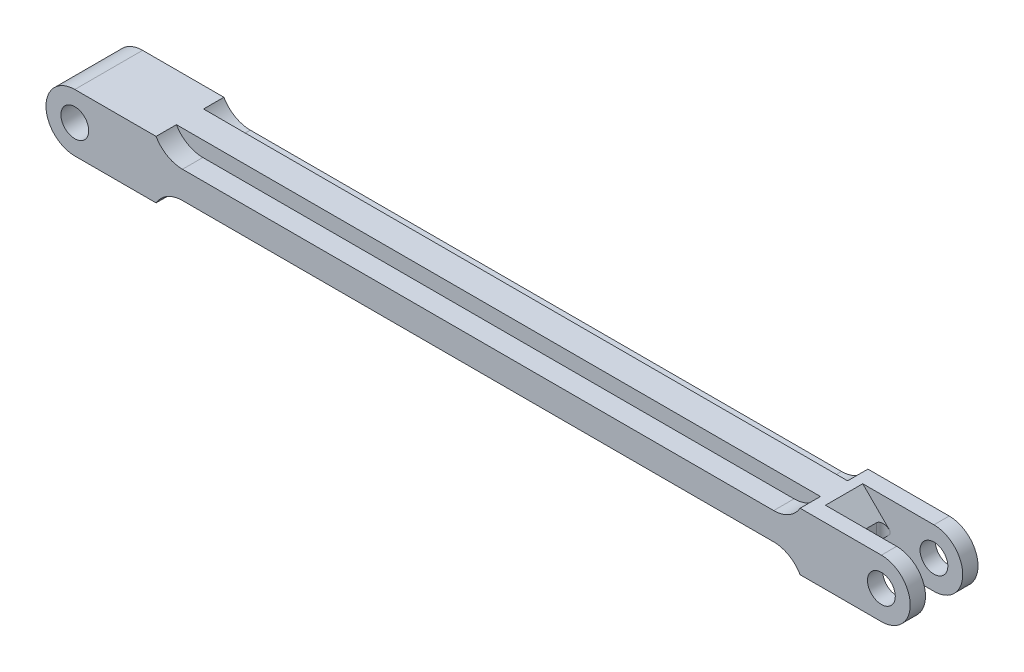
from build123d import *

# Parameters (mm, degrees)
ESBO_O1_R                = 4.1
RESSALTO_EXTRUS_O1_DEPTH = 10
ESBO_O2_W                = 23.5
ESBO_O2_H                = 11
CORTE_EXTRUS_O1_DEPTH    = 219.274311432
FILETE1_R                = 2
ESBO_O4_W                = 190
ESBO_O4_H                = 36.622024969
CORTE_EXTRUS_O3_DEPTH    = 289.339020898
RESSALTO_EXTRUS_O2_DEPTH = 190
FILETE3_R                = 9
CORTE_EXTRUS_O4_DEPTH    = 5.5


with BuildPart() as part:
    # Esboço1 → Ressalto-extrusão1 (new, symmetric)
    with BuildSketch(Plane.XY):
        with BuildLine():
            Line((-29.071712183, 188.373872767), (208.88140452, 188.373872767))
            ThreePointArc((208.88140452, 188.373872767), (217.38140452, 179.873872767), (208.88140452, 171.373872767))
            Line((208.88140452, 171.373872767), (-29.071712183, 171.373872767))
            ThreePointArc((-29.071712183, 171.373872767), (-37.571712183, 179.873872767), (-29.071712183, 188.373872767))
        make_face()
        with Locations((-29.071712183, 179.873872767)):
            Circle(ESBO_O1_R, mode=Mode.SUBTRACT)
        with Locations((208.88140452, 179.873872767)):
            Circle(ESBO_O1_R, mode=Mode.SUBTRACT)
    extrude(amount=RESSALTO_EXTRUS_O1_DEPTH, both=True)

    # Esboço2 → Corte-extrusão1 (cut, through all)
    with BuildSketch(Plane(origin=(0, 188.373872767, 0), x_dir=(1, 0, 0), z_dir=(0, 1, 0))):
        with Locations((205.63140452, 0)):
            Rectangle(ESBO_O2_W, ESBO_O2_H)
    extrude(amount=-CORTE_EXTRUS_O1_DEPTH, mode=Mode.SUBTRACT)

    # Filete1
    filete1_edges = [part.edges().sort_by_distance(p)[0] for p in [
        (193.88140452, 179.873872767, -5.5),
        (193.88140452, 179.873872767, 5.5),
    ]]
    fillet(filete1_edges, radius=FILETE1_R)

    # Esboço4 → Corte-extrusão3 (cut, through all)
    with BuildSketch(Plane.XY.offset(10)):
        with Locations((89.904846169, 172.82617811)):
            Rectangle(ESBO_O4_W, ESBO_O4_H)
    extrude(amount=-CORTE_EXTRUS_O3_DEPTH, mode=Mode.SUBTRACT)


with BuildPart() as corte_extrus_o3_piece_1:
    # of the separate pieces the step leaves, piece 1, a body of its own (corte_extrus_o3_pieces)
    add(part.part.solids().sort_by_distance((-5.095153831, 188.373872767, -10))[0])



with BuildPart() as corte_extrus_o3_piece_2:
    # of the separate pieces the step leaves, piece 2, a body of its own (corte_extrus_o3_pieces)
    add(part.part.solids().sort_by_distance((193.88140452, 188.373872767, 3.5))[0])


with BuildPart() as corte_extrus_o3_piece_1_1:
    add(corte_extrus_o3_piece_1.part)

    add(corte_extrus_o3_piece_2.part)  # Ressalto-extrusão2 merges Corte-extrusão3 piece 2
    # Esboço5 → Ressalto-extrusão2 (add)
    with BuildSketch(Plane(origin=(-5.095153831, 0, 0), x_dir=(0, 0, -1), z_dir=(1, 0, 0))):
        Polygon((4, 171.373872767), (-4, 171.373872767), (-4, 175.873872767), (-10, 175.873872767), (-10, 183.873872767), (-4, 183.873872767), (-4, 188.373872767), (4, 188.373872767), (4, 183.873872767), (10, 183.873872767), (10, 175.873872767), (4, 175.873872767), align=None)
    extrude(amount=RESSALTO_EXTRUS_O2_DEPTH)

    # Filete3
    # the kernel refuses this fillet: 9 mm, written as the material it adds along each edge
    with BuildSketch(Plane(origin=(-5.095153831, 183.873872767, 10), x_dir=(1, 0, 0), z_dir=(0, 0, -1))) as filete3_piece_1_section:
        with BuildLine():
            CenterArc((7.794228634, -9), FILETE3_R, 90, 60)
            Line((0, -4.5), (-0.155884573, -4.41))
            ThreePointArc((-0.155884573, -4.41), (-0.18, -2.25), (-0.18, 0))
            Line((-0.18, 0), (0, 0.18))
            Line((0, 0.18), (7.794228634, 0.18))
            Line((7.794228634, 0.18), (7.794228634, 0))
        make_face()
    filete3_piece_1 = extrude(amount=25.485571585, mode=Mode.PRIVATE)
    filete3_piece_1 = split(filete3_piece_1, bisect_by=Plane(origin=(-5.095153831, 183.873872767, -10), z_dir=(0, 0, 1)), keep=Keep.TOP, mode=Mode.PRIVATE)
    add(filete3_piece_1)
    with BuildSketch(Plane(origin=(184.904846169, 175.873872767, -15.485571585), x_dir=(0, -1, 0), z_dir=(0, 0, 1))) as filete3_piece_2_section:
        with BuildLine():
            CenterArc((9, -7.794228634), FILETE3_R, 120, 60)
            Line((0, -7.794228634), (-0.18, -7.794228634))
            Line((-0.18, -7.794228634), (-0.18, 0))
            Line((-0.18, 0), (0, 0.18))
            ThreePointArc((0, 0.18), (2.25, 0.18), (4.41, 0.155884573))
            Line((4.41, 0.155884573), (4.5, 0))
        make_face()
    filete3_piece_2 = extrude(amount=25.485571585, mode=Mode.PRIVATE)
    filete3_piece_2 = split(filete3_piece_2, bisect_by=Plane(origin=(184.904846169, 175.873872767, -10), z_dir=(0, 0, 1)), keep=Keep.TOP, mode=Mode.PRIVATE)
    add(filete3_piece_2)
    with BuildSketch(Plane(origin=(184.904846169, 175.873872767, -10), x_dir=(0, -1, 0), z_dir=(0, 0, 1))) as filete3_piece_3_section:
        with BuildLine():
            CenterArc((9, -7.794228634), FILETE3_R, 120, 60)
            Line((0, -7.794228634), (-0.18, -7.794228634))
            Line((-0.18, -7.794228634), (-0.18, 0))
            Line((-0.18, 0), (0, 0.18))
            ThreePointArc((0, 0.18), (2.25, 0.18), (4.41, 0.155884573))
            Line((4.41, 0.155884573), (4.5, 0))
        make_face()
    filete3_piece_3 = extrude(amount=25.485571585, mode=Mode.PRIVATE)
    filete3_piece_3 = split(filete3_piece_3, bisect_by=Plane(origin=(184.904846169, 175.873872767, 10), z_dir=(0, 0, -1)), keep=Keep.TOP, mode=Mode.PRIVATE)
    add(filete3_piece_3)
    with BuildSketch(Plane(origin=(184.904846169, 183.873872767, 10), x_dir=(0, 1, 0), z_dir=(0, 0, -1))) as filete3_piece_4_section:
        with BuildLine():
            CenterArc((9, -7.794228634), FILETE3_R, 120, 60)
            Line((0, -7.794228634), (-0.18, -7.794228634))
            Line((-0.18, -7.794228634), (-0.18, 0))
            Line((-0.18, 0), (0, 0.18))
            ThreePointArc((0, 0.18), (2.25, 0.18), (4.41, 0.155884573))
            Line((4.41, 0.155884573), (4.5, 0))
        make_face()
    filete3_piece_4 = extrude(amount=25.485571585, mode=Mode.PRIVATE)
    filete3_piece_4 = split(filete3_piece_4, bisect_by=Plane(origin=(184.904846169, 183.873872767, -10), z_dir=(0, 0, 1)), keep=Keep.TOP, mode=Mode.PRIVATE)
    add(filete3_piece_4)
    with BuildSketch(Plane(origin=(184.904846169, 183.873872767, 15.485571585), x_dir=(0, 1, 0), z_dir=(0, 0, -1))) as filete3_piece_5_section:
        with BuildLine():
            CenterArc((9, -7.794228634), FILETE3_R, 120, 60)
            Line((0, -7.794228634), (-0.18, -7.794228634))
            Line((-0.18, -7.794228634), (-0.18, 0))
            Line((-0.18, 0), (0, 0.18))
            ThreePointArc((0, 0.18), (2.25, 0.18), (4.41, 0.155884573))
            Line((4.41, 0.155884573), (4.5, 0))
        make_face()
    filete3_piece_5 = extrude(amount=25.485571585, mode=Mode.PRIVATE)
    filete3_piece_5 = split(filete3_piece_5, bisect_by=Plane(origin=(184.904846169, 183.873872767, 10), z_dir=(0, 0, -1)), keep=Keep.TOP, mode=Mode.PRIVATE)
    add(filete3_piece_5)
    with BuildSketch(Plane(origin=(-5.095153831, 175.873872767, -10), x_dir=(1, 0, 0), z_dir=(0, 0, 1))) as filete3_piece_6_section:
        with BuildLine():
            CenterArc((7.794228634, -9), FILETE3_R, 90, 60)
            Line((0, -4.5), (-0.155884573, -4.41))
            ThreePointArc((-0.155884573, -4.41), (-0.18, -2.25), (-0.18, 0))
            Line((-0.18, 0), (0, 0.18))
            Line((0, 0.18), (7.794228634, 0.18))
            Line((7.794228634, 0.18), (7.794228634, 0))
        make_face()
    filete3_piece_6 = extrude(amount=25.485571585, mode=Mode.PRIVATE)
    filete3_piece_6 = split(filete3_piece_6, bisect_by=Plane(origin=(-5.095153831, 175.873872767, 10), z_dir=(0, 0, -1)), keep=Keep.TOP, mode=Mode.PRIVATE)
    add(filete3_piece_6)
    with BuildSketch(Plane(origin=(-5.095153831, 183.873872767, 15.485571585), x_dir=(0, 1, 0), z_dir=(0, 0, -1))) as filete3_piece_7_section:
        with BuildLine():
            CenterArc((9, 7.794228634), FILETE3_R, 180, 60)
            Line((0, 7.794228634), (-0.18, 7.794228634))
            Line((-0.18, 7.794228634), (-0.18, 0))
            Line((-0.18, 0), (0, -0.18))
            ThreePointArc((0, -0.18), (2.25, -0.18), (4.41, -0.155884573))
            Line((4.41, -0.155884573), (4.5, 0))
        make_face()
    filete3_piece_7 = extrude(amount=25.485571585, mode=Mode.PRIVATE)
    filete3_piece_7 = split(filete3_piece_7, bisect_by=Plane(origin=(-5.095153831, 183.873872767, 10), z_dir=(0, 0, -1)), keep=Keep.TOP, mode=Mode.PRIVATE)
    add(filete3_piece_7)
    with BuildSketch(Plane(origin=(-5.095153831, 175.873872767, -15.485571585), x_dir=(1, 0, 0), z_dir=(0, 0, 1))) as filete3_piece_8_section:
        with BuildLine():
            CenterArc((7.794228634, -9), FILETE3_R, 90, 60)
            Line((0, -4.5), (-0.155884573, -4.41))
            ThreePointArc((-0.155884573, -4.41), (-0.18, -2.25), (-0.18, 0))
            Line((-0.18, 0), (0, 0.18))
            Line((0, 0.18), (7.794228634, 0.18))
            Line((7.794228634, 0.18), (7.794228634, 0))
        make_face()
    filete3_piece_8 = extrude(amount=25.485571585, mode=Mode.PRIVATE)
    filete3_piece_8 = split(filete3_piece_8, bisect_by=Plane(origin=(-5.095153831, 175.873872767, -10), z_dir=(0, 0, 1)), keep=Keep.TOP, mode=Mode.PRIVATE)
    add(filete3_piece_8)

    # Esboço6 → Corte-extrusão4 (cut, symmetric)
    with BuildSketch(Plane.XY):
        Polygon((208.88140452, 179.873872767), (196.38140452, 179.873872767), (187.88140452, 188.373872767), (187.88140452, 194.300401894), (208.88140452, 194.300401894), align=None)
    corte_extrus_o4 = extrude(amount=CORTE_EXTRUS_O4_DEPTH, both=True, mode=Mode.SUBTRACT)

    # Espelhar1: Corte-extrusão4 across plane
    add(corte_extrus_o4.mirror(Plane.ZX.offset(179.873872767)), mode=Mode.SUBTRACT)


solid = corte_extrus_o3_piece_1_1.part
